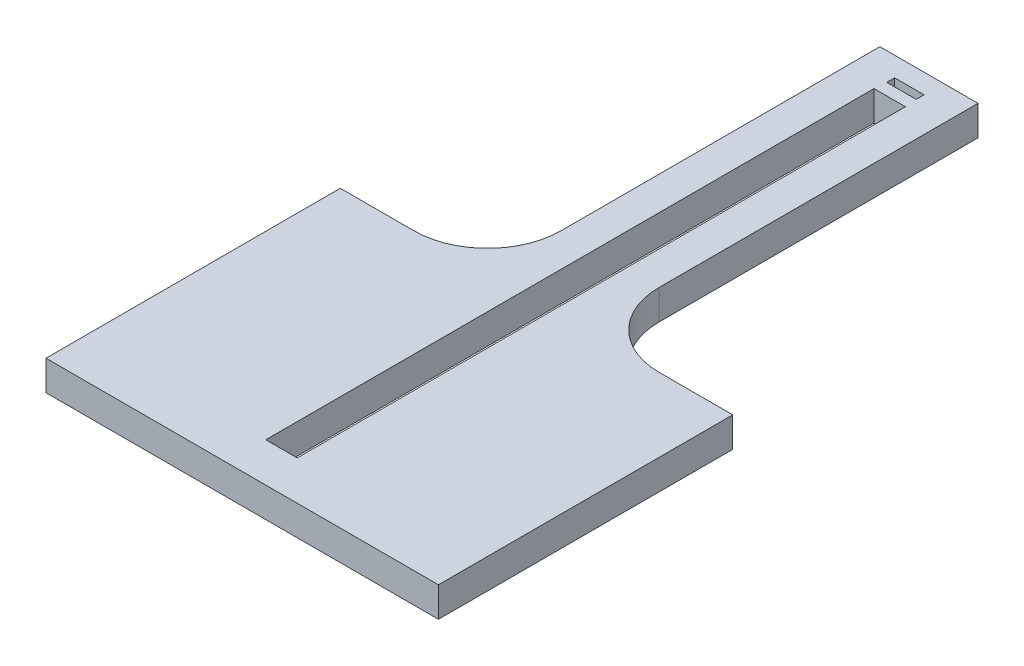
from build123d import *

# Parameters (mm, degrees)
SKETCH1_W           = 40
SKETCH1_H           = 70
BOSS_EXTRUDE1_DEPTH = 3.05
SKETCH4_W           = 3
SKETCH4_H           = 0.8
SKETCH4_W_2         = 3.2
SKETCH4_H_2         = 62
CUT_EXTRUDE1_DEPTH  = 10
CUT_EXTRUDE2_DEPTH  = 10


with BuildPart() as part:
    # Sketch1 → Boss-Extrude1 (new body)
    with BuildSketch(Plane(origin=(0, 0, 0), x_dir=(1, 0, 0), z_dir=(0, 1, 0))):
        with Locations((20, 35)):
            Rectangle(SKETCH1_W, SKETCH1_H)
    extrude(amount=BOSS_EXTRUDE1_DEPTH)

    # Sketch4 → Cut-Extrude1 (cut)
    with BuildSketch(Plane(origin=(0, 3.05, 0), x_dir=(1, 0, 0), z_dir=(0, 1, 0))):
        with Locations((20, 67.6)):
            Rectangle(SKETCH4_W, SKETCH4_H)
        with Locations((20, 35)):
            Rectangle(SKETCH4_W_2, SKETCH4_H_2)
    extrude(amount=-CUT_EXTRUDE1_DEPTH, mode=Mode.SUBTRACT)

    # Sketch5 → Cut-Extrude2 (cut)
    with BuildSketch(Plane(origin=(0, 3.05, 0), x_dir=(1, 0, 0), z_dir=(0, 1, 0))):
        with BuildLine():
            Line((15, 70), (0, 70))
            Line((0, 70), (0, 30))
            Line((0, 30), (7.5, 30))
            ThreePointArc((7.5, 30), (12.803300859, 32.196699141), (15, 37.5))
            Line((15, 37.5), (15, 70))
        make_face()
        with BuildLine():
            Line((40, 70), (25, 70))
            Line((25, 70), (25, 37.5))
            ThreePointArc((25, 37.5), (27.196699141, 32.196699141), (32.5, 30))
            Line((32.5, 30), (40, 30))
            Line((40, 30), (40, 70))
        make_face()
    extrude(amount=-CUT_EXTRUDE2_DEPTH, mode=Mode.SUBTRACT)


solid = part.part
